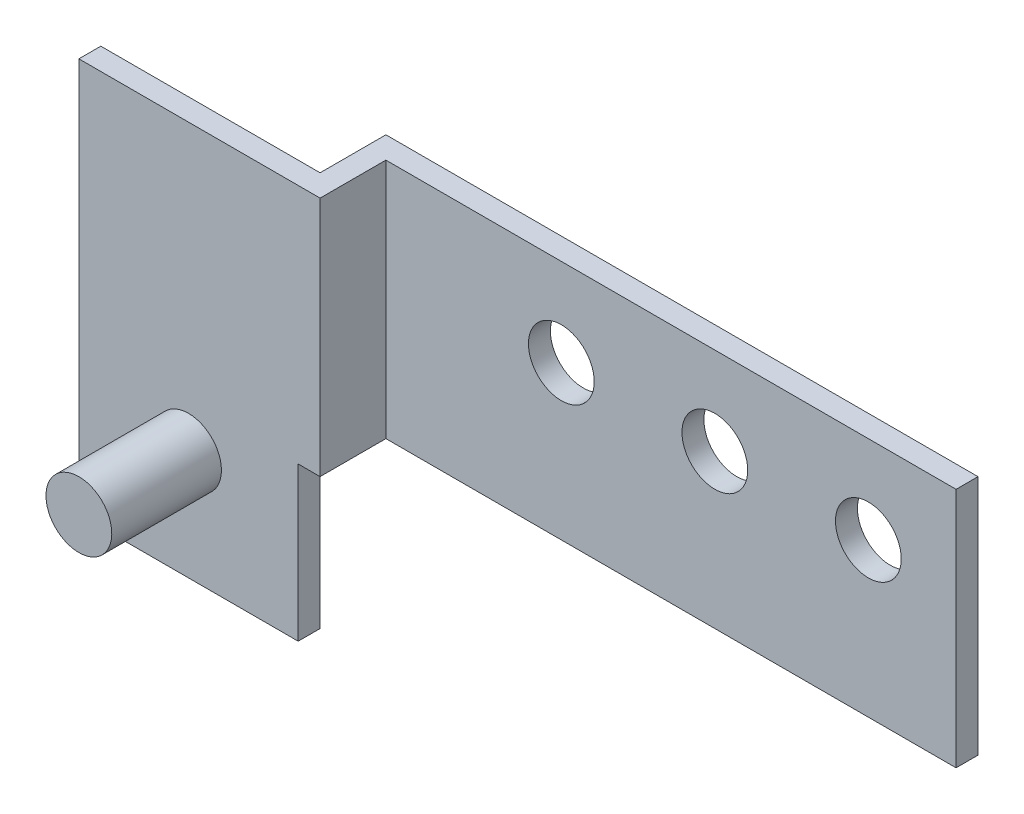
from build123d import *

# Parameters (mm, degrees)
SKETCH_1_W            = 37
SKETCH_1_H            = 18
EXTRUDE_1_DEPTH       = 1
SKETCH_2_W            = 27
SKETCH_2_H            = 7
CUT_EXTRUDE_1_DEPTH   = 33.465366161
SKETCH_3_W            = 27
SKETCH_3_H            = 11
EXTRUDE_2_DEPTH       = 3
SKETCH_4_W            = 26
SKETCH_4_H            = 3
CUT_EXTRUDE_2_DEPTH   = 30.427877939
SKETCH_5_W            = 1.5
SKETCH_5_H            = 5
HOLE_WIZARD_3_0_3_1_D = 3


with BuildPart() as part:
    # Эскиз1 → Бобышка-Вытянуть1 (new body)
    with BuildSketch(Plane.XY.offset(4)):
        with Locations((8.5, -9)):
            Rectangle(SKETCH_1_W, SKETCH_1_H)
    extrude(amount=-EXTRUDE_1_DEPTH)

    # Эскиз2 → Вырез-Вытянуть1 (cut, through all)
    with BuildSketch(Plane.XY.offset(4)):
        with Locations((13.5, -14.5)):
            Rectangle(SKETCH_2_W, SKETCH_2_H)
    extrude(amount=-CUT_EXTRUDE_1_DEPTH, mode=Mode.SUBTRACT)

    # Эскиз3 → Бобышка-Вытянуть2 (add)
    with BuildSketch(Plane(origin=(0, 0, 3), x_dir=(-1, 0, 0), z_dir=(0, 0, -1))):
        with Locations((-13.5, -5.5)):
            Rectangle(SKETCH_3_W, SKETCH_3_H)
    extrude(amount=EXTRUDE_2_DEPTH)

    # Эскиз4 → Вырез-Вытянуть2 (cut, through all)
    with BuildSketch(Plane.XZ.offset(11)):
        with Locations((14, 2.5)):
            Rectangle(SKETCH_4_W, SKETCH_4_H)
    extrude(amount=-CUT_EXTRUDE_2_DEPTH, mode=Mode.SUBTRACT)

    # Эскиз5 → Повернуть1 (revolve)
    with BuildSketch(Plane.XZ.offset(13)):
        with Locations((-4.25, 6.5)):
            Rectangle(SKETCH_5_W, SKETCH_5_H)
    revolve(axis=Axis((-5, -13, 9), (0, 0, -1)))

    # Диаметр отверстия Ø3.0 (3)1 (through all)
    with Locations(Plane.XY.offset(1)):
        with Locations((23, -4), (16, -4), (9, -4)):
            Hole(HOLE_WIZARD_3_0_3_1_D / 2)


solid = part.part
